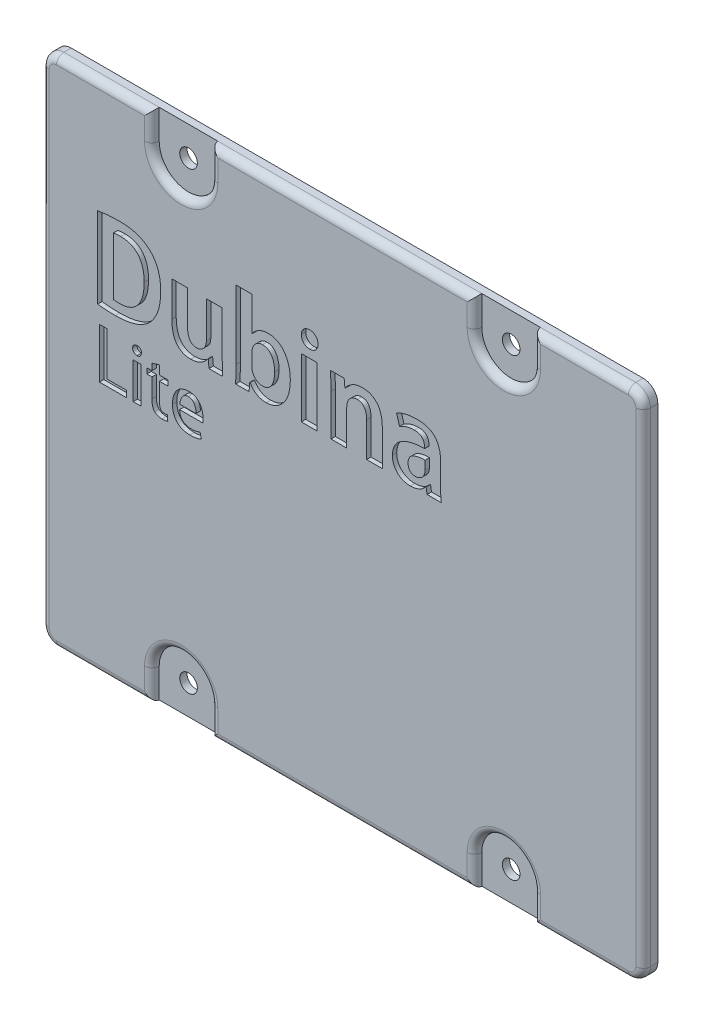
from build123d import *

# Parameters (mm, degrees)
EXTRUDE_1_DEPTH     = 2
SKETCH_2_3_R        = 1.2
EXTRUDE_2_DEPTH     = 1
FILLET_1_R          = 1
SKETCH_3_W          = 2.140804471
SKETCH_3_H          = 8.074367066
SKETCH_3_W_2        = 1.045585638
SKETCH_3_H_2        = 4.934335429
CUT_EXTRUDE_1_DEPTH = 0.6


with BuildPart() as part:
    # Эскиз2 → Бобышка-Вытянуть1 (new body)
    with BuildSketch(Plane.XY):
        with BuildLine():
            Line((-26, 35), (-39, 35))
            ThreePointArc((-39, 35), (-40.414213562, 34.414213562), (-41, 33))
            Line((-41, 33), (-41, -33))
            ThreePointArc((-41, -33), (-40.414213562, -34.414213562), (-39, -35))
            Line((-39, -35), (-26, -35))
            Line((-26, -35), (-26, -31))
            ThreePointArc((-26, -31), (-22, -27), (-18, -31))
            Line((-18, -31), (-18, -35))
            Line((-18, -35), (18, -35))
            Line((18, -35), (18, -31))
            ThreePointArc((18, -31), (22, -27), (26, -31))
            Line((26, -31), (26, -35))
            Line((26, -35), (39, -35))
            ThreePointArc((39, -35), (40.414213562, -34.414213562), (41, -33))
            Line((41, -33), (41, 33))
            ThreePointArc((41, 33), (40.414213562, 34.414213562), (39, 35))
            Line((39, 35), (26, 35))
            Line((26, 35), (26, 31))
            ThreePointArc((26, 31), (22, 27), (18, 31))
            Line((18, 31), (18, 35))
            Line((18, 35), (-18, 35))
            Line((-18, 35), (-18, 31))
            ThreePointArc((-18, 31), (-22, 27), (-26, 31))
            Line((-26, 31), (-26, 35))
        make_face()
    extrude(amount=EXTRUDE_1_DEPTH)

    # Эскиз2<3> → Бобышка-Вытянуть2 (add)
    # profile 1 of 4: a face of its own
    with BuildSketch(Plane.XY):
        with BuildLine():
            Line((-26, -31), (-26, -35))
            Line((-26, -35), (-18, -35))
            Line((-18, -35), (-18, -31))
            ThreePointArc((-18, -31), (-22, -27), (-26, -31))
        make_face()
        with Locations((-22, -31)):
            Circle(SKETCH_2_3_R, mode=Mode.SUBTRACT)
    # profile 2 of 4: a face of its own
    with BuildSketch(Plane.XY):
        with BuildLine():
            Line((18, -31), (18, -35))
            Line((18, -35), (26, -35))
            Line((26, -35), (26, -31))
            ThreePointArc((26, -31), (22, -27), (18, -31))
        make_face()
        with Locations((22, -31)):
            Circle(SKETCH_2_3_R, mode=Mode.SUBTRACT)
    # profile 3 of 4: a face of its own
    with BuildSketch(Plane.XY):
        with BuildLine():
            Line((26, 35), (18, 35))
            Line((18, 35), (18, 31))
            ThreePointArc((18, 31), (22, 27), (26, 31))
            Line((26, 31), (26, 35))
        make_face()
        with Locations((22, 31)):
            Circle(SKETCH_2_3_R, mode=Mode.SUBTRACT)
    # profile 4 of 4: a face of its own
    with BuildSketch(Plane.XY):
        with BuildLine():
            Line((-18, 35), (-26, 35))
            Line((-26, 35), (-26, 31))
            ThreePointArc((-26, 31), (-22, 27), (-18, 31))
            Line((-18, 31), (-18, 35))
        make_face()
        with Locations((-22, 31)):
            Circle(SKETCH_2_3_R, mode=Mode.SUBTRACT)
    extrude(amount=EXTRUDE_2_DEPTH)

    # Скругление1
    fillet_1_edges = [part.edges().sort_by_distance(p)[0] for p in [
        (-40.414213562, 34.414213562, 2),
        (-32.5, 35, 2),
        (-26, 33, 2),
        (-22, 27, 2),
        (-18, 33, 2),
        (0, 35, 2),
        (18, 33, 2),
        (22, 27, 2),
        (26, 33, 2),
        (32.5, 35, 2),
        (40.414213562, 34.414213562, 2),
        (41, 0, 2),
        (40.414213562, -34.414213562, 2),
        (32.5, -35, 2),
        (26, -33, 2),
        (22, -27, 2),
        (18, -33, 2),
        (0, -35, 2),
        (-18, -33, 2),
        (-22, -27, 2),
        (-26, -33, 2),
        (-32.5, -35, 2),
        (-40.414213562, -34.414213562, 2),
        (-41, 0, 2),
    ]]
    fillet(fillet_1_edges, radius=FILLET_1_R - 0.0001)  # a hair under: the kernel refuses the full size

    # Эскиз3 → Вырез-Вытянуть1 (cut)
    # profile 1 of 12: a face of its own
    with BuildSketch(Plane.XY.offset(2)):
        with BuildLine():
            add(Edge.make_bspline(
                [(-33.393138538, 8.551452839), (-33.318030964, 8.541044655), (-33.159637509, 8.519094961), (-32.910901713, 8.492266855), (-32.63963818, 8.46970589), (-32.346804749, 8.448066403), (-32.032064953, 8.431786433), (-31.695602907, 8.418995646), (-31.338044059, 8.41123396), (-31.092197084, 8.407392867), (-30.965769964, 8.40541758)],
                knots=[0, 0, 0, 0, 0.747798485, 1.577023202, 2.466955376, 3.432305679, 4.472841868, 5.575028817, 6.752955478, 8, 8, 8, 8], degree=3))
            add(Edge.make_bspline(
                [(-30.965769964, 8.40541758), (-30.730327991, 8.409248475), (-30.271198838, 8.416719003), (-29.602997505, 8.480841027), (-28.973494521, 8.58450489), (-28.385542019, 8.733650196), (-27.838633629, 8.923449635), (-27.33908479, 9.161868004), (-26.879926511, 9.436459292), (-26.611943507, 9.661788615), (-26.479777506, 9.772918334)],
                knots=[0, 0, 0, 0, 1.17842423, 2.298013867, 3.356996017, 4.369259479, 5.331192529, 6.249700563, 7.136773321, 8, 8, 8, 8], degree=3))
            add(Edge.make_bspline(
                [(-26.479777506, 9.772918334), (-26.42442458, 9.822878728), (-26.311908631, 9.924433273), (-26.150554082, 10.091364319), (-25.998608994, 10.278053983), (-25.84656794, 10.477391819), (-25.708164035, 10.698774065), (-25.566686543, 10.932064415), (-25.435870065, 11.184966624), (-25.30797249, 11.4539149), (-25.188579404, 11.741663319), (-25.089502015, 12.053234884), (-24.999436099, 12.383830551), (-24.930132654, 12.736998966), (-24.869260561, 13.11056633), (-24.829989895, 13.506132916), (-24.798093338, 13.922693804), (-24.792673044, 14.207571767), (-24.789892136, 14.353729797)],
                knots=[0, 0, 0, 0, 0.711529635, 1.446327024, 2.212730038, 3.007707617, 3.836959069, 4.702581573, 5.611055214, 6.552559085, 7.54462654, 8.581167827, 9.670545423, 10.812911411, 12.014096724, 13.281372547, 14.605194915, 16, 16, 16, 16], degree=3))
            add(Edge.make_bspline(
                [(-24.789892136, 14.353729797), (-24.791799031, 14.47807321), (-24.795529354, 14.721317296), (-24.816289673, 15.079235854), (-24.852778376, 15.422842491), (-24.899650411, 15.752975283), (-24.963917224, 16.06843176), (-25.03926506, 16.369531355), (-25.127070629, 16.657084811), (-25.23109106, 16.929651274), (-25.347334081, 17.1887836), (-25.473260981, 17.436471654), (-25.612961956, 17.670153921), (-25.762456793, 17.892531842), (-25.924341095, 18.100999957), (-26.09895528, 18.29520502), (-26.281282549, 18.480377501), (-26.413560216, 18.592066442), (-26.479777506, 18.647977157)],
                knots=[0, 0, 0, 0, 1.250196122, 2.445668869, 3.60292861, 4.723409941, 5.796680955, 6.837975795, 7.843086112, 8.817515314, 9.76895262, 10.69744629, 11.609358382, 12.504409608, 13.39005195, 14.260302496, 15.129119398, 16, 16, 16, 16], degree=3))
            add(Edge.make_bspline(
                [(-26.479777506, 18.647977157), (-26.598595544, 18.742761407), (-26.83871198, 18.934308555), (-27.241309456, 19.174139821), (-27.679844374, 19.375887665), (-28.156207151, 19.54427422), (-28.675941132, 19.670995188), (-29.242198664, 19.76352234), (-29.857102303, 19.817302649), (-30.28366833, 19.824318113), (-30.504317475, 19.827946991)],
                knots=[0, 0, 0, 0, 0.850789701, 1.719339872, 2.61723906, 3.551911928, 4.545442216, 5.610282156, 6.763874371, 8, 8, 8, 8], degree=3))
            add(Edge.make_bspline(
                [(-30.504317475, 19.827946991), (-30.770593889, 19.82554478), (-31.290226405, 19.820856917), (-31.929365663, 19.77968562), (-32.416063916, 19.735990418), (-32.757845589, 19.692212876), (-33.082776308, 19.647512735), (-33.29280261, 19.610168021), (-33.395243569, 19.591953025)],
                knots=[0, 0, 0, 0, 1.650018419, 3.219974348, 3.967566001, 4.678084243, 5.355231624, 6, 6, 6, 6], degree=3))
            Line((-33.395243569, 19.591953025), (-33.393138538, 8.551452839))
        make_face()
        with BuildLine():
            add(Edge.make_bspline(
                [(-31.252334067, 18.031715359), (-31.188537733, 18.043403777), (-31.04826475, 18.06910383), (-30.815799289, 18.091651715), (-30.543982864, 18.111999216), (-30.349146054, 18.115253599), (-30.24514553, 18.116990732)],
                knots=[0, 0, 0, 0, 0.76869223, 1.690171609, 2.76705349, 4, 4, 4, 4], degree=3))
            add(Edge.make_bspline(
                [(-30.24514553, 18.116990732), (-30.123506281, 18.114287351), (-29.886406197, 18.109017902), (-29.541218959, 18.064340125), (-29.217170387, 17.989628458), (-28.911143589, 17.891430244), (-28.629459778, 17.752367435), (-28.364313148, 17.592107554), (-28.122506467, 17.397023439), (-27.900110499, 17.175580067), (-27.700699455, 16.922844384), (-27.527366677, 16.639200271), (-27.383809338, 16.324696505), (-27.258419619, 15.983399975), (-27.169902154, 15.609371275), (-27.098941346, 15.207888026), (-27.057524719, 14.775987263), (-27.050311522, 14.478132768), (-27.046584444, 14.324230551)],
                knots=[0, 0, 0, 0, 1.034636826, 2.016721417, 2.954616098, 3.861659027, 4.743652532, 5.62095741, 6.492606741, 7.379948462, 8.28614458, 9.224914536, 10.200706863, 11.223314941, 12.31319917, 13.465574242, 14.690455408, 16, 16, 16, 16], degree=3))
            add(Edge.make_bspline(
                [(-27.046584444, 14.324230551), (-27.050817963, 14.147139134), (-27.058997428, 13.804985752), (-27.104805999, 13.309910726), (-27.180807831, 12.852524884), (-27.280006469, 12.430208269), (-27.410534116, 12.045635918), (-27.568239793, 11.696457744), (-27.756104566, 11.385480056), (-27.970750393, 11.110458448), (-28.209820239, 10.872086589), (-28.468857931, 10.666230065), (-28.746478472, 10.491263748), (-29.046382057, 10.351984282), (-29.36531728, 10.24504382), (-29.703278376, 10.168424061), (-30.061427953, 10.126219447), (-30.306844506, 10.123889656), (-30.43267645, 10.122695106)],
                knots=[0, 0, 0, 0, 1.382790342, 2.671650606, 3.877892401, 5.000458499, 6.054825918, 7.043745429, 7.986092149, 8.88452668, 9.760866288, 10.615577842, 11.46308158, 12.316807429, 13.190810493, 14.084799087, 15.018022824, 16, 16, 16, 16], degree=3))
            add(Edge.make_bspline(
                [(-30.43267645, 10.122695106), (-30.507841092, 10.121089792), (-30.653306169, 10.117983051), (-30.86479072, 10.128225769), (-31.063247463, 10.141101133), (-31.190598922, 10.15850651), (-31.252334067, 10.166943975)],
                knots=[0, 0, 0, 0, 1.0974001, 2.123783006, 3.090481336, 4, 4, 4, 4], degree=3))
            Line((-31.252334067, 10.166943975), (-31.252334067, 18.031715359))
        make_face(mode=Mode.SUBTRACT)
    # profile 2 of 12: a face of its own
    with BuildSketch(Plane.XY.offset(2)):
        with BuildLine():
            Line((-18.559232052, 16.606207927), (-18.559232052, 11.63409728))
            add(Edge.make_bspline(
                [(-18.559232052, 11.63409728), (-18.566794255, 11.524487696), (-18.581277232, 11.314565676), (-18.660845772, 11.018992172), (-18.782919933, 10.756861624), (-18.955326415, 10.538607355), (-19.15803687, 10.361957412), (-19.38521809, 10.233382725), (-19.632676016, 10.151544277), (-19.80530386, 10.13940076), (-19.893017325, 10.133230551)],
                knots=[0, 0, 0, 0, 1.179015692, 2.25802659, 3.271398766, 4.266941286, 5.225354467, 6.145233723, 7.057579747, 8, 8, 8, 8], degree=3))
            add(Edge.make_bspline(
                [(-19.893017325, 10.133230551), (-19.946467553, 10.135725089), (-20.050450482, 10.140578003), (-20.201198575, 10.164542928), (-20.339343934, 10.210313415), (-20.46648561, 10.268846312), (-20.582271312, 10.34310891), (-20.68444158, 10.435638816), (-20.775736436, 10.544179259), (-20.854799433, 10.668921111), (-20.924534535, 10.806560652), (-20.983521503, 10.956904298), (-21.031291497, 11.120061309), (-21.071273992, 11.295295199), (-21.102480527, 11.483184493), (-21.125744487, 11.682834131), (-21.138586666, 11.895287153), (-21.138402192, 12.04083179), (-21.138306917, 12.11600129)],
                knots=[0, 0, 0, 0, 0.970111335, 1.887270113, 2.757316712, 3.600661993, 4.42030127, 5.241127285, 6.090797025, 6.984664766, 7.913162656, 8.885278701, 9.908852515, 10.993376472, 12.142964809, 13.361072668, 14.637072075, 16, 16, 16, 16], degree=3))
            Line((-21.138306917, 12.11600129), (-21.138306917, 16.606207927))
            Line((-21.138306917, 16.606207927), (-23.279111388, 16.606207927))
            Line((-23.279111388, 16.606207927), (-23.279111388, 11.798437875))
            add(Edge.make_bspline(
                [(-23.279111388, 11.798437875), (-23.277018338, 11.653441202), (-23.272979591, 11.373655786), (-23.232836744, 10.970507003), (-23.177514586, 10.597933484), (-23.100754041, 10.254884318), (-22.999729138, 9.943494991), (-22.880316945, 9.661178121), (-22.735956294, 9.411785225), (-22.573805862, 9.190064642), (-22.390230863, 9.0000533), (-22.194180569, 8.833953753), (-21.980901613, 8.695563214), (-21.752705793, 8.584295148), (-21.510440102, 8.496941726), (-21.253198083, 8.436283103), (-20.981375389, 8.39923432), (-20.794971837, 8.397746833), (-20.700032407, 8.396989224)],
                knots=[0, 0, 0, 0, 1.433410501, 2.765907269, 4.002642214, 5.156811599, 6.237479393, 7.236132151, 8.182067156, 9.08085115, 9.945465735, 10.788525471, 11.616923183, 12.452510876, 13.293966855, 14.15819078, 15.061926052, 16, 16, 16, 16], degree=3))
            add(Edge.make_bspline(
                [(-20.700032407, 8.396989224), (-20.623429128, 8.400455951), (-20.473439885, 8.407243803), (-20.254425478, 8.429787293), (-20.047014664, 8.466187848), (-19.851257026, 8.512056061), (-19.666290196, 8.568589772), (-19.493463968, 8.638812445), (-19.33078813, 8.717974047), (-19.135268096, 8.838003884), (-18.918779965, 8.998250895), (-18.690755445, 9.196593308), (-18.500965349, 9.398158919), (-18.40360824, 9.544670426), (-18.356949451, 9.61488666)],
                knots=[0, 0, 0, 0, 1.002239885, 1.962385977, 2.8755572, 3.752951768, 4.589276476, 5.400792547, 6.189126677, 6.951201867, 8.396379851, 9.703982279, 10.899624208, 12, 12, 12, 12], degree=3))
            Line((-18.356949451, 9.61488666), (-18.313315836, 9.616600727))
            Line((-18.313315836, 9.616600727), (-18.212056218, 8.531840861))
            Line((-18.212056218, 8.531840861), (-16.345607491, 8.531840861))
            add(Edge.make_bspline(
                [(-16.345607491, 8.531840861), (-16.355801559, 8.710912621), (-16.377180405, 9.086459228), (-16.396854909, 9.676595244), (-16.411283956, 10.31860388), (-16.417374397, 10.763946089), (-16.42053467, 10.995029948)],
                knots=[0, 0, 0, 0, 0.873285086, 1.831440378, 2.874754927, 4, 4, 4, 4], degree=3))
            Line((-16.42053467, 10.995029948), (-16.418429639, 16.606207927))
            Line((-16.418429639, 16.606207927), (-18.559232052, 16.606207927))
        make_face()
    # profile 3 of 12: a face of its own
    with BuildSketch(Plane.XY.offset(2)):
        with BuildLine():
            Line((-12.372816721, 20.247255643), (-14.513621192, 20.247255643))
            Line((-14.513621192, 20.247255643), (-14.513621192, 10.877677026))
            add(Edge.make_bspline(
                [(-14.513621192, 10.877677026), (-14.51522432, 10.660425309), (-14.518382581, 10.232425805), (-14.529502972, 9.704751272), (-14.540073498, 9.30228061), (-14.551269805, 9.025592372), (-14.561550927, 8.770623565), (-14.569036072, 8.607695166), (-14.572617626, 8.52973583)],
                knots=[0, 0, 0, 0, 1.664880021, 3.279918044, 4.044519703, 4.750125368, 5.401949591, 6, 6, 6, 6], degree=3))
            Line((-14.572617626, 8.52973583), (-12.748810701, 8.531840861))
            Line((-12.748810701, 8.531840861), (-12.647551083, 9.687478345))
            Line((-12.647551083, 9.687478345), (-12.604154104, 9.687478345))
            add(Edge.make_bspline(
                [(-12.604154104, 9.687478345), (-12.538992106, 9.579166388), (-12.413346963, 9.370319643), (-12.184990941, 9.098163985), (-11.936344518, 8.872241871), (-11.663183425, 8.696460389), (-11.37251717, 8.563028444), (-11.065488805, 8.470208177), (-10.743328738, 8.413782678), (-10.523024183, 8.408235407), (-10.411116872, 8.40541758)],
                knots=[0, 0, 0, 0, 1.131224551, 2.181223318, 3.170642443, 4.13078333, 5.079824189, 6.02748669, 6.998029518, 8, 8, 8, 8], degree=3))
            add(Edge.make_bspline(
                [(-10.411116872, 8.40541758), (-10.30419891, 8.408861133), (-10.092072629, 8.415693175), (-9.779109786, 8.464100568), (-9.476988904, 8.549970645), (-9.186010258, 8.668207299), (-8.904463009, 8.819490195), (-8.635388903, 9.005588363), (-8.376257626, 9.225503572), (-8.128019641, 9.476345175), (-7.900567959, 9.763352196), (-7.698217989, 10.083964801), (-7.528953964, 10.440632547), (-7.384927601, 10.828773232), (-7.274669489, 11.251956868), (-7.190766906, 11.707518464), (-7.136277157, 12.197687878), (-7.122652521, 12.535879337), (-7.115629693, 12.710200385)],
                knots=[0, 0, 0, 0, 0.847449944, 1.68134896, 2.502719537, 3.331902851, 4.166396421, 5.031225821, 5.920181802, 6.857197951, 7.824106615, 8.817361735, 9.855764383, 10.947927019, 12.09450585, 13.317559317, 14.617333883, 16, 16, 16, 16], degree=3))
            add(Edge.make_bspline(
                [(-7.115629693, 12.710200385), (-7.119543561, 12.856377627), (-7.127197481, 13.142240272), (-7.16715244, 13.560465746), (-7.232399201, 13.956698042), (-7.319876765, 14.331178463), (-7.433915057, 14.682988308), (-7.573508284, 15.0125614), (-7.735387073, 15.321236756), (-7.920622091, 15.60575603), (-8.125786594, 15.863641361), (-8.353020054, 16.088108946), (-8.596042058, 16.281481752), (-8.857042331, 16.441976248), (-9.138017105, 16.563766175), (-9.434881852, 16.654179148), (-9.749137578, 16.715982748), (-9.965522763, 16.725607956), (-10.076089723, 16.730526177)],
                knots=[0, 0, 0, 0, 1.258613326, 2.461330713, 3.613433494, 4.713391422, 5.768892021, 6.793100615, 7.791148573, 8.765544853, 9.711748599, 10.622452917, 11.509175615, 12.380257356, 13.252052325, 14.137599147, 15.048363683, 16, 16, 16, 16], degree=3))
            add(Edge.make_bspline(
                [(-10.076089723, 16.730526177), (-10.202020167, 16.726201539), (-10.44608576, 16.717819966), (-10.799628432, 16.661078785), (-11.125873524, 16.563934875), (-11.425956491, 16.430168221), (-11.697835953, 16.263280793), (-11.944437372, 16.066891127), (-12.162673919, 15.839053554), (-12.284296929, 15.666686928), (-12.345424564, 15.580055589)],
                knots=[0, 0, 0, 0, 1.137196293, 2.203998325, 3.223492524, 4.203095137, 5.162612269, 6.096781389, 7.043443732, 8, 8, 8, 8], degree=3))
            Line((-12.345424564, 15.580055589), (-12.372816721, 15.581650309))
            Line((-12.372816721, 15.581650309), (-12.372816721, 20.247255643))
        make_face()
        with BuildLine():
            add(Edge.make_bspline(
                [(-12.372816721, 13.308025155), (-12.369330119, 13.370785007), (-12.362503885, 13.493659197), (-12.340114966, 13.673826386), (-12.302137968, 13.844392841), (-12.251013147, 14.004688602), (-12.190875379, 14.156109073), (-12.114180522, 14.295466117), (-12.024853754, 14.425061704), (-11.892341848, 14.582234609), (-11.707320746, 14.748941772), (-11.46013863, 14.899506173), (-11.191312476, 14.991506668), (-11.004591856, 15.005963407), (-10.910496963, 15.013248651)],
                knots=[0, 0, 0, 0, 0.908426032, 1.778559225, 2.620947371, 3.430072183, 4.208687216, 4.971927617, 5.723807717, 6.480334157, 7.93974638, 9.30127749, 10.640021615, 12, 12, 12, 12], degree=3))
            add(Edge.make_bspline(
                [(-10.910496963, 15.013248651), (-10.842912833, 15.009105026), (-10.711760151, 15.001063974), (-10.521321705, 14.964694068), (-10.344522008, 14.907932865), (-10.179940664, 14.832301269), (-10.030575166, 14.732936962), (-9.893484555, 14.615177111), (-9.769752252, 14.476101573), (-9.661892416, 14.317684167), (-9.564335761, 14.145315872), (-9.483840331, 13.958513363), (-9.410340143, 13.762426676), (-9.35489295, 13.553224116), (-9.3104255, 13.333702181), (-9.27913688, 13.102851719), (-9.259893699, 12.860836653), (-9.257601182, 12.695487547), (-9.256432106, 12.611167203)],
                knots=[0, 0, 0, 0, 0.993416888, 1.927808926, 2.837694666, 3.714244227, 4.578022629, 5.462783605, 6.361142406, 7.302281864, 8.271861941, 9.264475635, 10.285606373, 11.343816068, 12.43794596, 13.572585426, 14.762131615, 16, 16, 16, 16], degree=3))
            add(Edge.make_bspline(
                [(-9.256432106, 12.611167203), (-9.258623114, 12.517042255), (-9.262894954, 12.333525433), (-9.279427871, 12.065747277), (-9.317676131, 11.814484589), (-9.361244576, 11.57780026), (-9.424588203, 11.358407646), (-9.493294017, 11.152058113), (-9.584246941, 10.964912576), (-9.681480216, 10.79124063), (-9.79316706, 10.636432197), (-9.918739406, 10.502168664), (-10.056455712, 10.388044741), (-10.204480122, 10.292159877), (-10.364574244, 10.217145537), (-10.536538064, 10.165697481), (-10.719434281, 10.130144013), (-10.845703756, 10.125221181), (-10.910496963, 10.122695106)],
                knots=[0, 0, 0, 0, 1.348300097, 2.628800938, 3.837789757, 4.985751026, 6.071630837, 7.105398901, 8.09517776, 9.04575416, 9.953046414, 10.8211399, 11.671039994, 12.507987558, 13.340390576, 14.192964346, 15.072747904, 16, 16, 16, 16], degree=3))
            add(Edge.make_bspline(
                [(-10.910496963, 10.122695106), (-10.963991489, 10.125889759), (-11.068704729, 10.132143155), (-11.221502499, 10.15870416), (-11.367474607, 10.194318787), (-11.503329639, 10.251546015), (-11.632184953, 10.318363732), (-11.753532302, 10.398957648), (-11.865861916, 10.494543695), (-12.002370363, 10.640778195), (-12.14912298, 10.84686843), (-12.277462392, 11.12526357), (-12.354487162, 11.432787038), (-12.366572695, 11.64708071), (-12.372816721, 11.757796162)],
                knots=[0, 0, 0, 0, 0.788858868, 1.544157359, 2.282030985, 2.996834577, 3.70961312, 4.418475268, 5.137907402, 5.877230683, 7.361586745, 8.843126943, 10.368992307, 12, 12, 12, 12], degree=3))
            Line((-12.372816721, 11.757796162), (-12.372816721, 13.308025155))
        make_face(mode=Mode.SUBTRACT)
    # profile 4 of 12: a face of its own
    with BuildSketch(Plane.XY.offset(2)):
        with BuildLine():
            add(Edge.make_bspline(
                [(-3.337619134, 18.83963789), (-3.342605214, 18.920084543), (-3.352236553, 19.07547896), (-3.4111892, 19.29707262), (-3.512418009, 19.492334349), (-3.648962999, 19.66037178), (-3.816229876, 19.799433125), (-4.015013316, 19.899443942), (-4.240704538, 19.961875025), (-4.40057385, 19.970795242), (-4.483875545, 19.975443221)],
                knots=[0, 0, 0, 0, 1.067678627, 2.062376614, 3.016841452, 3.964320136, 4.917692493, 5.880446744, 6.895583054, 8, 8, 8, 8], degree=3))
            add(Edge.make_bspline(
                [(-4.483875545, 19.975443221), (-4.563684739, 19.970737216), (-4.718036819, 19.961635739), (-4.937109717, 19.898594007), (-5.133135956, 19.799006218), (-5.299449513, 19.659618388), (-5.439477038, 19.493750376), (-5.53577317, 19.295626112), (-5.602567078, 19.075726743), (-5.611006481, 18.918919901), (-5.615382332, 18.837615166)],
                knots=[0, 0, 0, 0, 1.066831069, 2.06326596, 3.025668899, 3.98697027, 4.948271641, 5.90639895, 6.914462685, 8, 8, 8, 8], degree=3))
            add(Edge.make_bspline(
                [(-5.615382332, 18.837615166), (-5.610416958, 18.758570768), (-5.600784716, 18.605233911), (-5.540931353, 18.386568421), (-5.442566064, 18.190510844), (-5.306182794, 18.021237125), (-5.139381054, 17.88088427), (-4.943480561, 17.777711093), (-4.721304322, 17.716230388), (-4.565035271, 17.705407879), (-4.483875545, 17.699787112)],
                knots=[0, 0, 0, 0, 1.057718482, 2.051849729, 3.010193927, 3.97308998, 4.940607778, 5.907577615, 6.913281758, 8, 8, 8, 8], degree=3))
            add(Edge.make_bspline(
                [(-4.483875545, 17.699787112), (-4.403434645, 17.703856375), (-4.247965182, 17.711721108), (-4.026904369, 17.771581731), (-3.831026085, 17.871401112), (-3.658455171, 18.003828597), (-3.518966173, 18.171820363), (-3.414587472, 18.368543996), (-3.354053381, 18.594698434), (-3.34325037, 18.754379144), (-3.337619134, 18.837615166)],
                knots=[0, 0, 0, 0, 1.065625004, 2.059551157, 3.009038306, 3.964579149, 4.923155116, 5.881188186, 6.895536802, 8, 8, 8, 8], degree=3))
            Line((-3.337619134, 18.837615166), (-3.337619134, 18.83963789))
        make_face()
    # profile 5 of 12: a face of its own
    with BuildSketch(Plane.XY.offset(2)):
        with Locations((-4.542875066, 12.569024394)):
            Rectangle(SKETCH_3_W, SKETCH_3_H)
    # profile 6 of 12: a face of its own
    with BuildSketch(Plane.XY.offset(2)):
        with BuildLine():
            Line((0.327334988, 15.51654661), (0.226075369, 16.606207927))
            Line((0.226075369, 16.606207927), (-1.625924159, 16.606207927))
            add(Edge.make_bspline(
                [(-1.625924159, 16.606207927), (-1.617978865, 16.42571828), (-1.601442865, 16.050077454), (-1.585118114, 15.464946011), (-1.575049306, 14.836283021), (-1.571570166, 14.402898493), (-1.569771472, 14.178841411)],
                knots=[0, 0, 0, 0, 0.89282334, 1.858172496, 2.892688618, 4, 4, 4, 4], degree=3))
            Line((-1.569771472, 14.178841411), (-1.567666441, 8.531840861))
            Line((-1.567666441, 8.531840861), (0.57313803, 8.531840861))
            Line((0.57313803, 8.531840861), (0.57313803, 13.338363944))
            add(Edge.make_bspline(
                [(0.57313803, 13.338363944), (0.577108197, 13.410697093), (0.584808189, 13.550984548), (0.611480952, 13.753371497), (0.653655881, 13.939413497), (0.708464296, 14.10950466), (0.775490647, 14.263803174), (0.855427769, 14.402804363), (0.951550226, 14.523914123), (1.092574255, 14.660714368), (1.28143877, 14.798506731), (1.518186009, 14.919056464), (1.759764961, 14.99414392), (1.92327966, 14.999884525), (2.003851454, 15.002713206)],
                knots=[0, 0, 0, 0, 1.062159612, 2.060019103, 2.989565638, 3.856020944, 4.677018154, 5.45256044, 6.200596125, 6.936260821, 8.328943673, 9.609547682, 10.822105713, 12, 12, 12, 12], degree=3))
            add(Edge.make_bspline(
                [(2.003851454, 15.002713206), (2.060106598, 14.999363786), (2.169622151, 14.992843252), (2.327747607, 14.969069239), (2.472563168, 14.926132357), (2.604537238, 14.869331454), (2.723673161, 14.797035636), (2.830935545, 14.709853042), (2.923167687, 14.605663272), (3.031321987, 14.447919665), (3.138195495, 14.222294105), (3.228883153, 13.922713445), (3.278611841, 13.589823824), (3.282784678, 13.357940987), (3.284961559, 13.236972633)],
                knots=[0, 0, 0, 0, 0.819984559, 1.596317342, 2.320790788, 3.011982078, 3.681600685, 4.342503711, 5.015623514, 5.698910004, 7.120561833, 8.627264371, 10.240515412, 12, 12, 12, 12], degree=3))
            Line((3.284961559, 13.236972633), (3.287066591, 8.531840861))
            Line((3.287066591, 8.531840861), (5.427869004, 8.531840861))
            Line((5.427869004, 8.531840861), (5.427869004, 13.46954258))
            add(Edge.make_bspline(
                [(5.427869004, 13.46954258), (5.423203476, 13.604935502), (5.414158764, 13.867411719), (5.373891951, 14.247253573), (5.313434627, 14.600091088), (5.232799668, 14.925732452), (5.126818617, 15.223568065), (4.998928197, 15.493644308), (4.848908364, 15.73721911), (4.674393714, 15.950113788), (4.484333817, 16.138644761), (4.280035567, 16.301112341), (4.062096748, 16.437698842), (3.832496007, 16.549228433), (3.589680157, 16.636924422), (3.333767137, 16.69721622), (3.064808898, 16.734146252), (2.881224216, 16.737331607), (2.787688558, 16.738954533)],
                knots=[0, 0, 0, 0, 1.367692787, 2.65144457, 3.853626784, 4.980360652, 6.034744203, 7.040411954, 7.992955059, 8.915668451, 9.813401669, 10.691790595, 11.545846867, 12.405480468, 13.264733617, 14.147236264, 15.056024321, 16, 16, 16, 16], degree=3))
            add(Edge.make_bspline(
                [(2.787688558, 16.738954533), (2.641274285, 16.73576857), (2.358577748, 16.729617117), (1.954146299, 16.658506027), (1.585092246, 16.545095555), (1.261470475, 16.375666388), (0.979447897, 16.17894509), (0.73234548, 15.973183549), (0.525888925, 15.754308357), (0.420016867, 15.592896404), (0.368750398, 15.51473583)],
                knots=[0, 0, 0, 0, 1.237745281, 2.389837407, 3.463172556, 4.491936586, 5.466326472, 6.368928413, 7.21018556, 8, 8, 8, 8], degree=3))
            Line((0.368750398, 15.51473583), (0.327334988, 15.51654661))
        make_face()
    # profile 7 of 12: a face of its own
    with BuildSketch(Plane.XY.offset(2)):
        with BuildLine():
            add(Edge.make_bspline(
                [(7.782452468, 14.686756858), (7.850978578, 14.729386662), (7.990762641, 14.816345738), (8.216050662, 14.925155649), (8.453901326, 15.025933664), (8.704503334, 15.11146855), (8.965192324, 15.179976034), (9.229989526, 15.234565474), (9.500266184, 15.263111181), (9.68132671, 15.269298513), (9.772688558, 15.272420596)],
                knots=[0, 0, 0, 0, 0.921222762, 1.879170737, 2.853605547, 3.870952631, 4.900374728, 5.930921604, 6.955957829, 8, 8, 8, 8], degree=3))
            add(Edge.make_bspline(
                [(9.772688558, 15.272420596), (9.840210058, 15.270872848), (9.970751241, 15.267880544), (10.15709742, 15.243212631), (10.327902384, 15.211753816), (10.479702271, 15.161976481), (10.617045934, 15.1043938), (10.73495549, 15.030145633), (10.837432443, 14.944352224), (10.948498459, 14.810956043), (11.058858373, 14.619876674), (11.145832565, 14.362632279), (11.198951834, 14.077791519), (11.197723086, 13.878478396), (11.197080715, 13.774280325)],
                knots=[0, 0, 0, 0, 1.015501891, 1.963297894, 2.825560386, 3.624409854, 4.362726652, 5.060679176, 5.712965577, 6.365251979, 7.663128898, 9.006844189, 10.435220624, 12, 12, 12, 12], degree=3))
            add(Edge.make_bspline(
                [(11.197080715, 13.774280325), (11.039693827, 13.772475725), (10.731564127, 13.768942705), (10.28055347, 13.73496463), (9.852325436, 13.677768263), (9.44607973, 13.601951557), (9.06389904, 13.496787197), (8.701762574, 13.374821249), (8.3642304, 13.222913394), (8.047100191, 13.055033543), (7.760518496, 12.859937912), (7.50754553, 12.639755421), (7.296243503, 12.390479148), (7.11824757, 12.117907044), (6.979747852, 11.818676861), (6.875779911, 11.495547397), (6.809443767, 11.147222909), (6.797365284, 10.906124628), (6.791157638, 10.78221396)],
                knots=[0, 0, 0, 0, 1.262205049, 2.471126202, 3.624785542, 4.726306887, 5.782663399, 6.801709071, 7.787818693, 8.74816751, 9.676318542, 10.562399853, 11.429455743, 12.288864775, 13.165892172, 14.065568705, 15.00581342, 16, 16, 16, 16], degree=3))
            add(Edge.make_bspline(
                [(6.791157638, 10.78221396), (6.793732877, 10.699199533), (6.798795621, 10.535998888), (6.834346665, 10.297232969), (6.885086817, 10.068632378), (6.961660902, 9.852746847), (7.049641493, 9.644287317), (7.166612914, 9.450154633), (7.298280323, 9.264247668), (7.450658871, 9.091138201), (7.62003724, 8.933345187), (7.807346295, 8.796028812), (8.008421715, 8.676325175), (8.22697296, 8.580422559), (8.459414674, 8.501695127), (8.707907936, 8.445082237), (8.971729978, 8.409432759), (9.153095661, 8.40120175), (9.24591631, 8.396989224)],
                knots=[0, 0, 0, 0, 1.039034809, 2.042670863, 3.017538516, 3.965866516, 4.906990884, 5.845111153, 6.796858029, 7.756494624, 8.727268264, 9.68935964, 10.659136981, 11.651147514, 12.671746341, 13.727687939, 14.837059593, 16, 16, 16, 16], degree=3))
            add(Edge.make_bspline(
                [(9.24591631, 8.396989224), (9.354941988, 8.400452696), (9.569073556, 8.407255118), (9.882877872, 8.454182408), (10.180881787, 8.532238167), (10.462549942, 8.63954808), (10.723477903, 8.776222416), (10.961898465, 8.93936803), (11.175923443, 9.130235011), (11.296551449, 9.27745731), (11.357219478, 9.351500536)],
                knots=[0, 0, 0, 0, 1.089521257, 2.139871092, 3.163177725, 4.163102539, 5.145903192, 6.1000057, 7.044426644, 8, 8, 8, 8], degree=3))
            Line((11.357219478, 9.351500536), (11.402997221, 9.351673383))
            Line((11.402997221, 9.351673383), (11.535225286, 8.531840861))
            Line((11.535225286, 8.531840861), (13.488109931, 8.531840861))
            add(Edge.make_bspline(
                [(13.488109931, 8.531840861), (13.477570784, 8.596388782), (13.4556308, 8.730762127), (13.431595284, 8.941057681), (13.40963693, 9.166464169), (13.391745623, 9.491130577), (13.372098014, 9.915976269), (13.370369315, 10.261030038), (13.369489463, 10.436651366)],
                knots=[0, 0, 0, 0, 0.616094179, 1.28256085, 1.993685948, 2.749466753, 4.34558259, 6, 6, 6, 6], degree=3))
            Line((13.369489463, 10.436651366), (13.371594494, 13.353708243))
            add(Edge.make_bspline(
                [(13.371594494, 13.353708243), (13.37166188, 13.469350921), (13.371794541, 13.697012257), (13.346766208, 14.032077843), (13.297712464, 14.352969168), (13.229873091, 14.660364924), (13.133481132, 14.95140201), (13.018385958, 15.229293938), (12.877394438, 15.491584492), (12.717606952, 15.741642793), (12.524521906, 15.970354096), (12.294332904, 16.169905701), (12.027807525, 16.339434702), (11.725217558, 16.477881288), (11.388261445, 16.589590797), (11.01463489, 16.670482386), (10.605709776, 16.723146816), (10.320697144, 16.733559727), (10.173035466, 16.738954533)],
                knots=[0, 0, 0, 0, 1.037939004, 2.043351001, 3.012684027, 3.950348011, 4.865589174, 5.761446226, 6.647171701, 7.535608735, 8.421289321, 9.324087164, 10.259862385, 11.247218489, 12.30401033, 13.440682476, 14.674047819, 16, 16, 16, 16], degree=3))
            add(Edge.make_bspline(
                [(10.173035466, 16.738954533), (10.021215328, 16.735321388), (9.725420776, 16.72824285), (9.295538096, 16.684907776), (8.891942239, 16.621078001), (8.518137356, 16.532072569), (8.177946939, 16.429039996), (7.872407539, 16.321806128), (7.604403019, 16.210744764), (7.443763004, 16.124198481), (7.368500021, 16.083649857)],
                knots=[0, 0, 0, 0, 1.252902983, 2.441058744, 3.56267823, 4.62278865, 5.609386748, 6.494886694, 7.294825038, 8, 8, 8, 8], degree=3))
            Line((7.368500021, 16.083649857), (7.782452468, 14.686756858))
        make_face()
        with BuildLine():
            add(Edge.make_bspline(
                [(11.256077149, 11.2702026), (11.251213123, 11.207913031), (11.241809326, 11.087486361), (11.215887169, 10.913757459), (11.172689128, 10.755588861), (11.121081905, 10.610780224), (11.054805026, 10.480821561), (10.977168124, 10.364021323), (10.885243621, 10.26152846), (10.749310258, 10.1468872), (10.571214404, 10.033287872), (10.354682478, 9.93457838), (10.142454186, 9.86935968), (9.999983132, 9.865432416), (9.930720232, 9.86352316)],
                knots=[0, 0, 0, 0, 1.043926595, 2.0182609, 2.929185394, 3.779426585, 4.582434006, 5.360352114, 6.116635953, 6.874011636, 8.325857533, 9.628293333, 10.846984866, 12, 12, 12, 12], degree=3))
            add(Edge.make_bspline(
                [(9.930720232, 9.86352316), (9.865033827, 9.865714254), (9.735783404, 9.870025644), (9.550784756, 9.923262269), (9.379707821, 10.006553803), (9.226821161, 10.125485627), (9.096468455, 10.281538334), (9.007086895, 10.481103304), (8.947216349, 10.715607209), (8.93862726, 10.885739492), (8.93406714, 10.976066147)],
                knots=[0, 0, 0, 0, 0.932689269, 1.835242495, 2.716319968, 3.628517603, 4.573510817, 5.580053048, 6.715201435, 8, 8, 8, 8], degree=3))
            add(Edge.make_bspline(
                [(8.93406714, 10.976066147), (8.938399396, 11.045878424), (8.946792123, 11.181123312), (8.991431275, 11.372675882), (9.048278765, 11.549390524), (9.132599946, 11.705729199), (9.233279623, 11.848249197), (9.360258224, 11.967272878), (9.503297416, 12.073829192), (9.725529988, 12.186236241), (10.029173885, 12.294073864), (10.415339196, 12.388126276), (10.826959037, 12.438790056), (11.109155516, 12.439915463), (11.253972117, 12.440492995)],
                knots=[0, 0, 0, 0, 0.812232766, 1.573510204, 2.281488938, 2.964950378, 3.63174977, 4.302044204, 4.980259673, 5.700253563, 7.189246091, 8.719149585, 10.31634467, 12, 12, 12, 12], degree=3))
            Line((11.253972117, 12.440492995), (11.256077149, 11.2702026))
        make_face(mode=Mode.SUBTRACT)
    # profile 8 of 12: a face of its own
    with BuildSketch(Plane.XY.offset(2)):
        Polygon((-29.486900788, 0.346747909), (-32.112543783, 0.346747909), (-32.112543783, 6.288035239), (-33.158129421, 6.288035239), (-33.158129421, -0.534015289), (-29.486900788, -0.534015289), align=None)
    # profile 9 of 12: a face of its own
    with BuildSketch(Plane.XY.offset(2)):
        with BuildLine():
            add(Edge.make_bspline(
                [(-27.415140062, 5.753026574), (-27.41808435, 5.795473689), (-27.423798948, 5.877859716), (-27.454498557, 5.995718711), (-27.507080925, 6.100647137), (-27.578270153, 6.191592098), (-27.666853251, 6.265731934), (-27.770430104, 6.321150046), (-27.889314594, 6.353305437), (-27.972935007, 6.358650184), (-28.016479848, 6.361433429)],
                knots=[0, 0, 0, 0, 1.064877965, 2.066832164, 3.02896069, 3.986568619, 4.941029699, 5.903458844, 6.908238459, 8, 8, 8, 8], degree=3))
            add(Edge.make_bspline(
                [(-28.016479848, 6.361433429), (-28.060028823, 6.358661684), (-28.143657176, 6.353339022), (-28.262855985, 6.320929763), (-28.367509268, 6.265452139), (-28.458355773, 6.191716802), (-28.53237917, 6.101147177), (-28.586020204, 5.995790675), (-28.618593708, 5.877851332), (-28.624029506, 5.795067542), (-28.626833292, 5.752367651)],
                knots=[0, 0, 0, 0, 1.084617084, 2.08282145, 3.048401414, 4.013093923, 4.977786432, 5.938445531, 6.936649897, 8, 8, 8, 8], degree=3))
            add(Edge.make_bspline(
                [(-28.626833292, 5.752367651), (-28.623953764, 5.711388486), (-28.618382773, 5.632106538), (-28.586678712, 5.518211026), (-28.534651751, 5.415335571), (-28.463274396, 5.324859202), (-28.375416228, 5.248648362), (-28.270575414, 5.194851489), (-28.152505657, 5.16004576), (-28.069100983, 5.154124007), (-28.025493506, 5.151027865)],
                knots=[0, 0, 0, 0, 1.037706738, 2.007639982, 2.969570996, 3.936640828, 4.907546925, 5.889090756, 6.896327739, 8, 8, 8, 8], degree=3))
            add(Edge.make_bspline(
                [(-28.025493506, 5.151027865), (-27.980208205, 5.154197912), (-27.893501753, 5.160267507), (-27.771491829, 5.193738794), (-27.665293287, 5.2487391), (-27.577410499, 5.32483566), (-27.506013612, 5.415339766), (-27.454088868, 5.518217569), (-27.421995235, 5.632033516), (-27.417475198, 5.711377216), (-27.415140062, 5.753026574)],
                knots=[0, 0, 0, 0, 1.134975354, 2.173104375, 3.144460336, 4.105288976, 5.062321169, 6.014267882, 6.974133768, 8, 8, 8, 8], degree=3))
        make_face()
    # profile 10 of 12: a face of its own
    with BuildSketch(Plane.XY.offset(2)):
        with Locations((-28.020343473, 1.925425176)):
            Rectangle(SKETCH_3_W_2, SKETCH_3_H_2)
    # profile 11 of 12: a face of its own
    with BuildSketch(Plane.XY.offset(2)):
        with BuildLine():
            Line((-25.988407953, 4.392591632), (-26.682645762, 4.392591632))
            Line((-26.682645762, 4.392591632), (-26.682645762, 3.661196374))
            Line((-26.682645762, 3.661196374), (-25.988407953, 3.661196374))
            Line((-25.988407953, 3.661196374), (-25.988407953, 1.056085608))
            add(Edge.make_bspline(
                [(-25.988407953, 1.056085608), (-25.988349315, 0.977543413), (-25.988237586, 0.827889506), (-25.968899564, 0.614334597), (-25.941943482, 0.421741298), (-25.902210579, 0.249282316), (-25.851066021, 0.095177205), (-25.786091439, -0.041328164), (-25.709702946, -0.162750931), (-25.646928717, -0.231377646), (-25.616271368, -0.2648932)],
                knots=[0, 0, 0, 0, 1.338813745, 2.550969074, 3.653487921, 4.653156515, 5.565206094, 6.416511258, 7.226664077, 8, 8, 8, 8], degree=3))
            add(Edge.make_bspline(
                [(-25.616271368, -0.2648932), (-25.586405381, -0.293078027), (-25.526538064, -0.349575404), (-25.425265063, -0.421730791), (-25.314830266, -0.482440008), (-25.195667125, -0.53263832), (-25.067729418, -0.572927948), (-24.930419895, -0.600418707), (-24.784524126, -0.619254198), (-24.68406445, -0.621639663), (-24.632494931, -0.622864208)],
                knots=[0, 0, 0, 0, 0.916216609, 1.836585241, 2.767573672, 3.725363857, 4.719722017, 5.75739415, 6.848790781, 8, 8, 8, 8], degree=3))
            add(Edge.make_bspline(
                [(-24.632494931, -0.622864208), (-24.549604565, -0.620822322), (-24.394282065, -0.616996175), (-24.177245957, -0.597413122), (-23.991280867, -0.564664768), (-23.881060083, -0.52869631), (-23.830279328, -0.512124975)],
                knots=[0, 0, 0, 0, 1.222825415, 2.29136761, 3.212801446, 4, 4, 4, 4], degree=3))
            Line((-23.830279328, -0.512124975), (-23.865863663, 0.25170713))
            add(Edge.make_bspline(
                [(-23.865863663, 0.25170713), (-23.896342415, 0.242420852), (-23.961078202, 0.222697127), (-24.067969356, 0.204556755), (-24.189240717, 0.191618123), (-24.275342697, 0.188648138), (-24.320879881, 0.187077388)],
                knots=[0, 0, 0, 0, 0.828271265, 1.759218748, 2.814906801, 4, 4, 4, 4], degree=3))
            add(Edge.make_bspline(
                [(-24.320879881, 0.187077388), (-24.371001404, 0.18893819), (-24.466454904, 0.192481978), (-24.60011447, 0.236139886), (-24.711938838, 0.311152323), (-24.803585842, 0.414934039), (-24.869702665, 0.549871474), (-24.916811264, 0.711309186), (-24.941042033, 0.901860533), (-24.942202351, 1.037735136), (-24.942822315, 1.110333547)],
                knots=[0, 0, 0, 0, 0.944409182, 1.798571902, 2.617459188, 3.462172229, 4.383625732, 5.433257573, 6.628577989, 8, 8, 8, 8], degree=3))
            Line((-24.942822315, 1.110333547), (-24.942822315, 3.661196374))
            Line((-24.942822315, 3.661196374), (-23.776858815, 3.661196374))
            Line((-23.776858815, 3.661196374), (-23.776858815, 4.392591632))
            Line((-23.776858815, 4.392591632), (-24.942822315, 4.392591632))
            Line((-24.942822315, 4.392591632), (-24.942822315, 5.603057556))
            Line((-24.942822315, 5.603057556), (-25.988407953, 5.282640105))
            Line((-25.988407953, 5.282640105), (-25.988407953, 4.392591632))
        make_face()
    # profile 12 of 12: a face of its own
    with BuildSketch(Plane.XY.offset(2)):
        with BuildLine():
            add(Edge.make_bspline(
                [(-19.419667887, 0.415113641), (-19.460407707, 0.398778187), (-19.543988972, 0.365264588), (-19.675242159, 0.321871704), (-19.814512787, 0.283415426), (-19.962554858, 0.249252942), (-20.122500374, 0.22246448), (-20.295595911, 0.201573277), (-20.483504871, 0.190782423), (-20.613250662, 0.188344048), (-20.680649531, 0.187077388)],
                knots=[0, 0, 0, 0, 0.816449075, 1.675015937, 2.570090404, 3.503798727, 4.500212016, 5.58578228, 6.745889613, 8, 8, 8, 8], degree=3))
            add(Edge.make_bspline(
                [(-20.680649531, 0.187077388), (-20.731328517, 0.187621899), (-20.830752726, 0.188690143), (-20.977230725, 0.202956805), (-21.118120373, 0.228647665), (-21.253919361, 0.266011051), (-21.38388432, 0.315123938), (-21.508670725, 0.374542593), (-21.62688015, 0.445717147), (-21.739738306, 0.526465055), (-21.844040432, 0.620709239), (-21.935084716, 0.730837242), (-22.014986656, 0.854558846), (-22.079561874, 0.993301091), (-22.134558283, 1.14517663), (-22.174662239, 1.311485348), (-22.2036225, 1.491892986), (-22.211475766, 1.617133777), (-22.2155468, 1.682057026)],
                knots=[0, 0, 0, 0, 1.004473861, 1.970619904, 2.913666576, 3.840642582, 4.758945718, 5.664823492, 6.576954953, 7.491029442, 8.41263867, 9.355109247, 10.315843508, 11.324526001, 12.382372671, 13.513400112, 14.710977933, 16, 16, 16, 16], degree=3))
            Line((-22.2155468, 1.682057026), (-19.028212547, 1.683343434))
            add(Edge.make_bspline(
                [(-19.028212547, 1.683343434), (-19.020246728, 1.742062247), (-19.003035577, 1.868931612), (-19.002896241, 1.996991354), (-19.002821393, 2.065781343)],
                knots=[0, 0, 0, 0, 0.925657864, 2, 2, 2, 2], degree=3))
            add(Edge.make_bspline(
                [(-19.002821393, 2.065781343), (-19.003524304, 2.1473686), (-19.004906349, 2.30778334), (-19.024310426, 2.544039626), (-19.059018644, 2.770740047), (-19.107866791, 2.987672459), (-19.170665946, 3.194633944), (-19.249570943, 3.391511303), (-19.344310422, 3.57838458), (-19.450974189, 3.756400043), (-19.575368635, 3.919652915), (-19.719662553, 4.062632888), (-19.88222183, 4.1845333), (-20.062875293, 4.286271365), (-20.263235857, 4.363765764), (-20.48049533, 4.423534952), (-20.716837406, 4.460426663), (-20.88054146, 4.469185154), (-20.965223605, 4.473715816)],
                knots=[0, 0, 0, 0, 1.113121608, 2.188590698, 3.231524324, 4.240398316, 5.220519018, 6.179837158, 7.130696028, 8.076961612, 9.008335956, 9.923659246, 10.83973185, 11.773313681, 12.743513307, 13.763749156, 14.843214244, 16, 16, 16, 16], degree=3))
            add(Edge.make_bspline(
                [(-20.965223605, 4.473715816), (-21.052497326, 4.469809691), (-21.222298722, 4.462209862), (-21.46924919, 4.423143015), (-21.699912981, 4.361267627), (-21.916198566, 4.279184448), (-22.115509695, 4.172455144), (-22.300249966, 4.044812994), (-22.466648831, 3.891956455), (-22.618658867, 3.720745595), (-22.753730173, 3.531644087), (-22.869050057, 3.327043376), (-22.968997729, 3.110605664), (-23.052038453, 2.880840295), (-23.114000643, 2.636463599), (-23.160511645, 2.379668458), (-23.189271536, 2.109777849), (-23.193368735, 1.92549664), (-23.19546024, 1.831426223)],
                knots=[0, 0, 0, 0, 1.077396504, 2.096202933, 3.077775868, 4.020080645, 4.944168237, 5.861017532, 6.78343394, 7.725158009, 8.681968589, 9.64506222, 10.619075267, 11.620944368, 12.65508274, 13.726198823, 14.839287928, 16, 16, 16, 16], degree=3))
            add(Edge.make_bspline(
                [(-23.19546024, 1.831426223), (-23.193468475, 1.741635609), (-23.189569017, 1.565844429), (-23.15949477, 1.309117244), (-23.110788855, 1.066194644), (-23.043601161, 0.83694867), (-22.958978526, 0.620882109), (-22.854335369, 0.41871428), (-22.729432388, 0.231349079), (-22.588692306, 0.056872374), (-22.428179324, -0.099348305), (-22.250979147, -0.236849594), (-22.056323692, -0.353253884), (-21.845010018, -0.448869932), (-21.616424913, -0.523382592), (-21.371574326, -0.578227294), (-21.109581695, -0.613700113), (-20.92928457, -0.619749585), (-20.836457056, -0.622864208)],
                knots=[0, 0, 0, 0, 1.119307265, 2.191368746, 3.217819697, 4.20508808, 5.166072403, 6.106755345, 7.037398497, 7.969333271, 8.896523305, 9.823527987, 10.759678815, 11.717678244, 12.709389534, 13.751911659, 14.842552517, 16, 16, 16, 16], degree=3))
            add(Edge.make_bspline(
                [(-20.836457056, -0.622864208), (-20.752287478, -0.621680755), (-20.588898941, -0.619383458), (-20.351390697, -0.600168909), (-20.128166486, -0.574241493), (-19.919856835, -0.536607235), (-19.727443041, -0.491806941), (-19.552039186, -0.44176713), (-19.394073559, -0.387525323), (-19.297409636, -0.343716756), (-19.251340833, -0.322838148)],
                knots=[0, 0, 0, 0, 1.242786686, 2.412476118, 3.517118367, 4.560308987, 5.536651868, 6.43345837, 7.253406084, 8, 8, 8, 8], degree=3))
            Line((-19.251340833, -0.322838148), (-19.419667887, 0.415113641))
        make_face()
        with BuildLine():
            add(Edge.make_bspline(
                [(-22.206348291, 2.3323281), (-22.197296229, 2.417643248), (-22.1791295, 2.588863603), (-22.114593618, 2.840510857), (-22.019989588, 3.086004379), (-21.921056907, 3.283944058), (-21.824672637, 3.432615076), (-21.740645764, 3.530817459), (-21.647287496, 3.615366239), (-21.544433229, 3.686073015), (-21.431241205, 3.741092264), (-21.309162487, 3.784235794), (-21.177075014, 3.812381657), (-21.085529615, 3.82054791), (-21.038620538, 3.824732407)],
                knots=[0, 0, 0, 0, 1.480585291, 2.971410676, 4.471042306, 6.019659947, 6.78467367, 7.52618554, 8.245416092, 8.954949748, 9.674524201, 10.413213234, 11.186909408, 12, 12, 12, 12], degree=3))
            add(Edge.make_bspline(
                [(-21.038620538, 3.824732407), (-20.98998521, 3.821127179), (-20.895812862, 3.814146394), (-20.760743984, 3.785673792), (-20.638008915, 3.742583505), (-20.524929421, 3.689153956), (-20.425481693, 3.618372263), (-20.336514323, 3.535224448), (-20.260179968, 3.437631323), (-20.17578668, 3.290567917), (-20.092779507, 3.093521857), (-20.022624874, 2.846569164), (-19.982542527, 2.591635533), (-19.981813993, 2.419167539), (-19.981447168, 2.3323281)],
                knots=[0, 0, 0, 0, 0.853261208, 1.652165519, 2.407983148, 3.127271917, 3.834084808, 4.535885489, 5.25305095, 5.994191112, 7.499104421, 8.983593183, 10.48120762, 12, 12, 12, 12], degree=3))
            Line((-19.981447168, 2.3323281), (-22.206348291, 2.3323281))
        make_face(mode=Mode.SUBTRACT)
    extrude(amount=-CUT_EXTRUDE_1_DEPTH, mode=Mode.SUBTRACT)


solid = part.part
